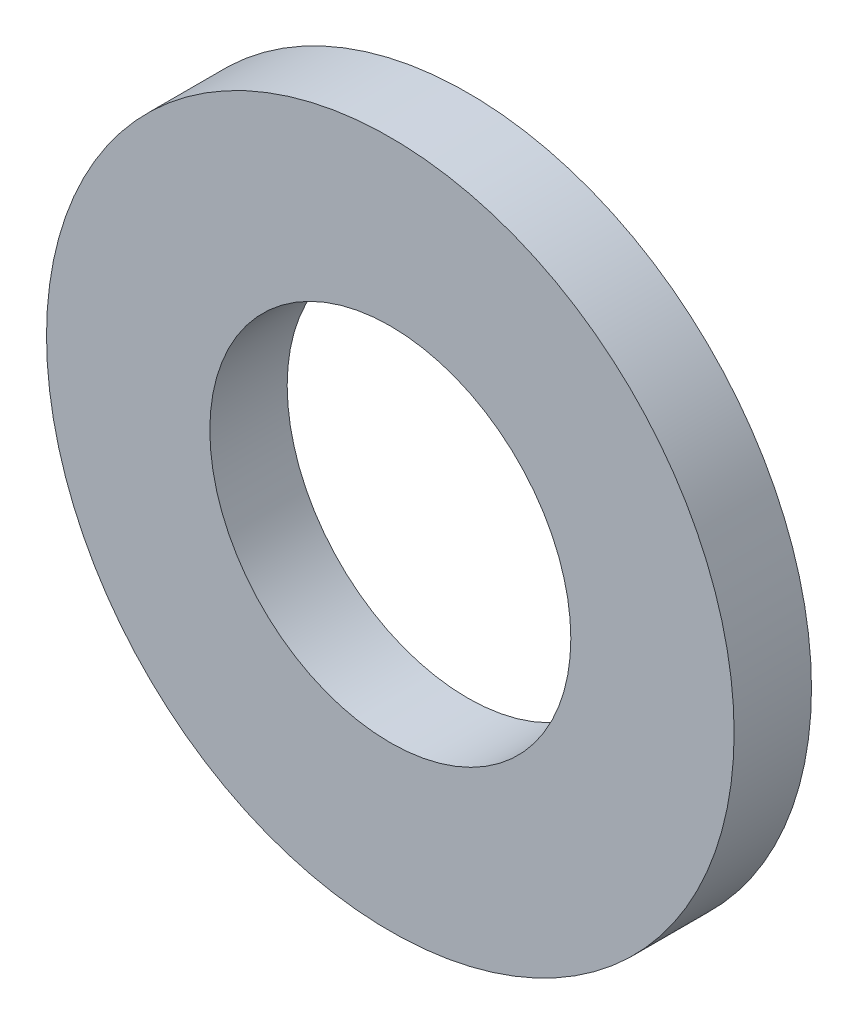
from build123d import *

# Parameters (mm, degrees)
SKETCH1_R           = 8
SKETCH1_R_2         = 4.2
BOSS_EXTRUDE1_DEPTH = 1.8


with BuildPart() as part:
    # Sketch1 → Boss-Extrude1 (new body)
    with BuildSketch(Plane.XY):
        Circle(SKETCH1_R)
        Circle(SKETCH1_R_2, mode=Mode.SUBTRACT)
    extrude(amount=BOSS_EXTRUDE1_DEPTH)


solid = part.part
